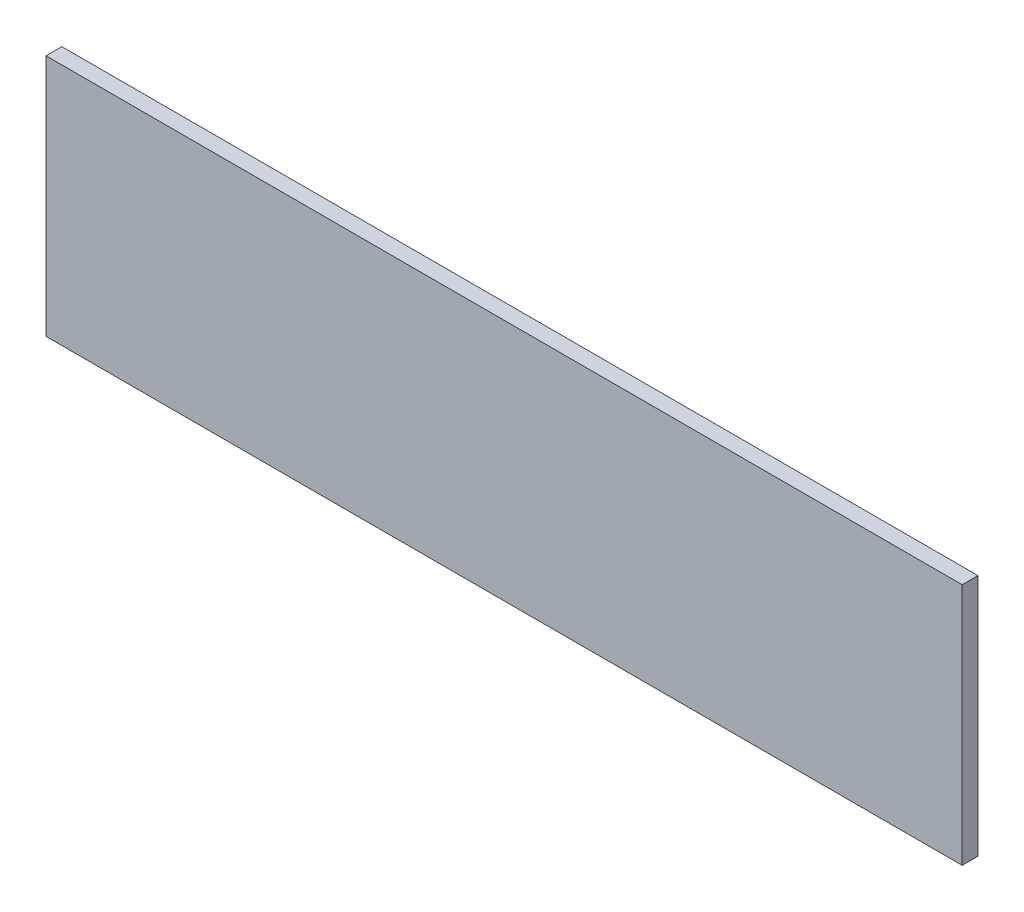
from build123d import *

# Parameters (mm, degrees)
ESQUISSE1_W        = 377
ESQUISSE1_H        = 100
BOSS_EXTRU_1_DEPTH = 6.5


with BuildPart() as part:
    # Esquisse1 → Boss.-Extru.1 (new body)
    with BuildSketch(Plane.XY):
        with Locations((49.054341942, 50.719339623)):
            Rectangle(ESQUISSE1_W, ESQUISSE1_H)
    extrude(amount=BOSS_EXTRU_1_DEPTH)


solid = part.part
